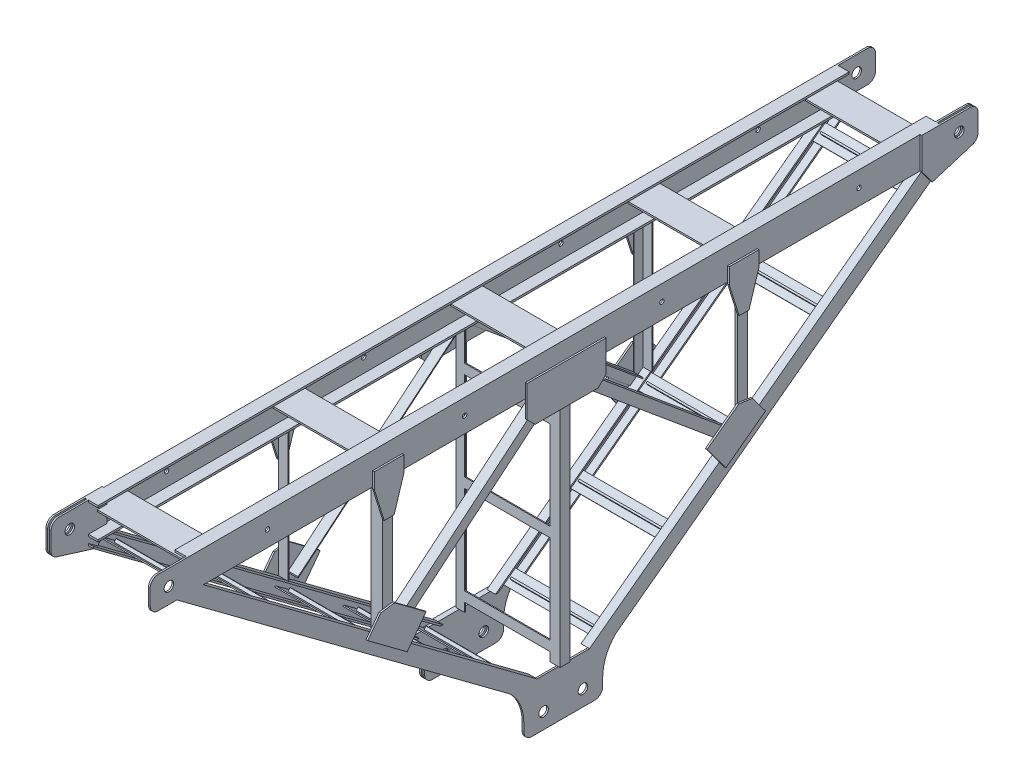
from build123d import *

# Parameters (mm, degrees)
EXTRUDE_1_DEPTH           = 4190
EXTRUDE_1_2_DEPTH         = 4190
SKETCH_7_W                = 400
SKETCH_7_H                = 240
EXTRUDE_4_DEPTH           = 520
SKETCH_8_W                = 503
SKETCH_8_H                = 400
CUT_EXTRUDE_5_DEPTH       = 4455.537012979
SKETCH_9_R                = 11
CUT_EXTRUDE_6_DEPTH       = 4481.68075185
EXTRUDE_8_DEPTH           = 43
EXTRUDE_8_2_DEPTH         = 43
CUT_EXTRUDE_9_DEPTH       = 38
EXTRUDE_10_DEPTH          = 43
EXTRUDE_10_2_DEPTH        = 43
CUT_EXTRUDE_11_DEPTH      = 38
SKETCH_17_W               = 50
SKETCH_17_H               = 1260
EXTRUDE_12_DEPTH          = 528.5
EXTRUDE_12_2_DEPTH        = 528.5
EXTRUDE_12_3_DEPTH        = 528.5
CUT_EXTRUDE_13_DEPTH      = 1260
SKETCH_22_W               = 390
SKETCH_22_H               = 1000
CUT_EXTRUDE_14_DEPTH      = 3414.167480508
SKETCH_23_W               = 50
SKETCH_23_H               = 707.63301644
CUT_EXTRUDE_15_DEPTH      = 15
SKETCH_25_W               = 50
SKETCH_25_H               = 707.63301644
CUT_EXTRUDE_16_DEPTH      = 15
CUT_EXTRUDE_17_DEPTH      = 45
CUT_EXTRUDE_18_DEPTH      = 45
EXTRUDE_19_DEPTH          = 50
CUT_EXTRUDE_20_DEPTH      = 45
EXTRUDE_21_DEPTH          = 50
CUT_EXTRUDE_22_DEPTH      = 45
SKETCH_32_W               = 400
SKETCH_32_H               = 200
EXTRUDE_23_DEPTH          = 8.5
PATTERN_LINEAR_7_COUNT    = 2
PATTERN_LINEAR_7_PITCH    = 537
EXTRUDE_24_DEPTH          = 520
PATTERN_LINEAR_8_COUNT    = 5
PATTERN_LINEAR_8_PITCH    = 900
EXTRUDE_25_DEPTH          = 520
SKETCH_35_W               = 448.5
SKETCH_35_H               = 8.5
EXTRUDE_26_DEPTH          = 15
PATTERN_LINEAR_9_COUNT    = 3
PATTERN_LINEAR_9_PITCH    = 430
PATTERN_LINEAR_10_COUNT   = 3
PATTERN_LINEAR_10_PITCH   = 550
MIRROR_13_COPY_1_DEPTH    = 520
MIRROR_13_COPY_2_DEPTH    = 520
MIRROR_13_COPY_3_SKETCH_W = 448.5
MIRROR_13_COPY_3_SKETCH_H = 8.5
MIRROR_13_COPY_3_DEPTH    = 15
MIRROR_13_COPY_4_SKETCH_W = 448.5
MIRROR_13_COPY_4_SKETCH_H = 8.5
MIRROR_13_COPY_4_DEPTH    = 15
MIRROR_13_COPY_5_DEPTH    = 520
MIRROR_13_COPY_6_DEPTH    = 520
MIRROR_13_COPY_7_SKETCH_W = 448.5
MIRROR_13_COPY_7_SKETCH_H = 8.5
MIRROR_13_COPY_7_DEPTH    = 15
MIRROR_13_COPY_8_SKETCH_W = 448.5
MIRROR_13_COPY_8_SKETCH_H = 8.5
MIRROR_13_COPY_8_DEPTH    = 15
SKETCH_36_W               = 50
SKETCH_36_H               = 50
EXTRUDE_27_DEPTH          = 520
SKETCH_37_W               = 510
SKETCH_37_H               = 45
CUT_EXTRUDE_28_DEPTH      = 45
PATTERN_LINEAR_11_COUNT   = 2
PATTERN_LINEAR_11_PITCH   = 500
PATTERN_LINEAR_13_COUNT   = 2
PATTERN_LINEAR_13_PITCH   = 500
SKETCH_38_W               = 503
SKETCH_38_H               = 190
CUT_EXTRUDE_29_DEPTH      = 4539.729888416
EXTRUDE_30_DEPTH          = 8.5
PATTERN_LINEAR_14_COUNT   = 2
PATTERN_LINEAR_14_PITCH   = 17
SKETCH_41_W               = 8.5
SKETCH_41_H               = 190
CUT_EXTRUDE_31_DEPTH      = 4539.729888416
SKETCH_42_R               = 24.25
CUT_EXTRUDE_32_DEPTH      = 4483.68546744
EXTRUDE_33_DEPTH          = 8.5
PATTERN_LINEAR_15_COUNT   = 2
PATTERN_LINEAR_15_PITCH   = 17
SKETCH_44_W               = 8.5
SKETCH_44_H               = 190
CUT_EXTRUDE_34_DEPTH      = 160
SKETCH_45_R               = 24.25
CUT_EXTRUDE_35_DEPTH      = 4484.711659998
FILLET_1_R                = 40
CHAMFER_1_SIZE            = 50
EXTRUDE_37_DEPTH          = 8.5
PATTERN_LINEAR_16_COUNT   = 3
PATTERN_LINEAR_16_PITCH   = 8.5
SKETCH_48_W               = 8.5
SKETCH_48_H               = 600
CUT_EXTRUDE_38_DEPTH      = 160
EXTRUDE_39_DEPTH          = 8.5
FILLET_2_R                = 40
SKETCH_50_R               = 24.25
CUT_EXTRUDE_40_DEPTH      = 4484.711659998
SKETCH_51_W               = 494.5
SKETCH_51_H               = 1000
CUT_EXTRUDE_41_DEPTH      = 4457.553488964
CHAMFER_2_SIZE            = 40
SKETCH_52_R               = 11
CUT_EXTRUDE_42_DEPTH      = 4482.675161142
PATTERN_LINEAR_17_COUNT   = 4
PATTERN_LINEAR_17_PITCH   = 1000


with BuildPart() as part:
    # 草图2 → 拉伸1 (new body)
    with BuildSketch(Plane.XY):
        Polygon((0, 0), (0, 160), (65, 160), (65, 150), (8.5, 150), (8.5, 10), (65, 10), (65, 0), align=None)
    extrude(amount=EXTRUDE_1_DEPTH)



with BuildPart() as body_2:
    # 草图2 → Extrude 1 2 (new body)
    with BuildSketch(Plane.XY):
        Polygon((455, 160), (520, 160), (520, 0), (455, 0), (455, 10), (511.5, 10), (511.5, 150), (455, 150), align=None)
    extrude(amount=EXTRUDE_1_2_DEPTH)



with BuildPart() as body_3:
    # 草图7 → 拉伸4 (new body)
    with BuildSketch(Plane(origin=(520, 0, 0), x_dir=(0, 0, -1), z_dir=(1, 0, 0))):
        with Locations((-2095, -1380)):
            Rectangle(SKETCH_7_W, SKETCH_7_H)
    extrude(amount=-EXTRUDE_4_DEPTH)

    # 草图8 → 拉伸5 (cut, through all)
    with BuildSketch(Plane(origin=(0, -1260, 0), x_dir=(1, 0, 0), z_dir=(0, 1, 0))):
        with Locations((260, -2095)):
            Rectangle(SKETCH_8_W, SKETCH_8_H)
    extrude(amount=-CUT_EXTRUDE_5_DEPTH, mode=Mode.SUBTRACT)


with BuildPart() as cut_extrude_5_piece_1:
    # of the separate pieces the step leaves, piece 1, a body of its own (cut_extrude_5_pieces)
    add(body_3.part.solids().sort_by_distance((8.5, -1260, 2295))[0])


with BuildPart() as cut_extrude_5_piece_2:
    # of the separate pieces the step leaves, piece 2, a body of its own (cut_extrude_5_pieces)
    add(body_3.part.solids().sort_by_distance((520, -1260, 2295))[0])


with BuildPart() as cut_extrude_6_tool:
    # 草图9 → 拉伸6 (new, through all)
    with BuildSketch(Plane(origin=(520, 0, 0), x_dir=(0, 0, -1), z_dir=(1, 0, 0))):
        with Locations((-2195, -1420)):
            Circle(SKETCH_9_R)
        with Locations((-1995, -1420)):
            Circle(SKETCH_9_R)
    extrude(amount=-CUT_EXTRUDE_6_DEPTH)


with BuildPart() as cut_extrude_5_piece_1_1:
    add(cut_extrude_5_piece_1.part)

    # 拉伸6: cut by cut_extrude_6_tool
    add(cut_extrude_6_tool.part, mode=Mode.SUBTRACT)


with BuildPart() as cut_extrude_5_piece_2_1:
    add(cut_extrude_5_piece_2.part)

    # 拉伸6: cut by cut_extrude_6_tool
    add(cut_extrude_6_tool.part, mode=Mode.SUBTRACT)


with BuildPart() as body_5:
    # 草图13 → 拉伸8 (new body)
    with BuildSketch(Plane(origin=(520, 0, 0), x_dir=(0, 0, -1), z_dir=(1, 0, 0))):
        Polygon((-1961.985500305, -1260), (-1895, -1260), (-1895, -1309.86698356), (-135.477186263, 0), (-269.448186872, 0), align=None)
    extrude(amount=-EXTRUDE_8_DEPTH)


with BuildPart() as body_6:
    # 草图13 → Extrude 8 2 (new body)
    with BuildSketch(Plane(origin=(520, 0, 0), x_dir=(0, 0, -1), z_dir=(1, 0, 0))):
        Polygon((-2228.014499695, -1260), (-2295, -1260), (-2295, -1309.86698356), (-4054.522813737, 0), (-3920.551813128, 0), align=None)
    extrude(amount=-EXTRUDE_8_2_DEPTH)


with BuildPart() as cut_extrude_9_tool:
    # 草图14 → 拉伸9 (new body)
    with BuildSketch(Plane.ZY.offset(-477)):
        Polygon((3933.948913189, 0), (4041.125713677, 0), (2295, -1299.893586848), (2295, -1260), (2241.411599756, -1260), align=None)
        Polygon((148.874286323, 0), (256.051086811, 0), (1948.588400244, -1260), (1895, -1260), (1895, -1299.893586848), align=None)
    extrude(amount=-CUT_EXTRUDE_9_DEPTH)


with BuildPart() as body_5_1:
    add(body_5.part)

    # 拉伸9: cut by cut_extrude_9_tool
    add(cut_extrude_9_tool.part, mode=Mode.SUBTRACT)


with BuildPart() as body_6_1:
    add(body_6.part)

    # 拉伸9: cut by cut_extrude_9_tool
    add(cut_extrude_9_tool.part, mode=Mode.SUBTRACT)


with BuildPart() as body_7:
    # 草图15 → 拉伸10 (new body)
    with BuildSketch(Plane.ZY):
        Polygon((3920.551813128, 0), (4054.522813737, 0), (2295, -1309.86698356), (2295, -1260), (2228.014499695, -1260), align=None)
    extrude(amount=-EXTRUDE_10_DEPTH)


with BuildPart() as body_8:
    # 草图15 → Extrude 10 2 (new body)
    with BuildSketch(Plane.ZY):
        Polygon((135.477186263, 0), (269.448186872, 0), (1961.985500305, -1260), (1895, -1260), (1895, -1309.86698356), align=None)
    extrude(amount=-EXTRUDE_10_2_DEPTH)


with BuildPart() as cut_extrude_11_tool:
    # 草图16 → 拉伸11 (new body)
    with BuildSketch(Plane(origin=(43, 0, 0), x_dir=(0, 0, -1), z_dir=(1, 0, 0))):
        Polygon((-3933.948913189, 0), (-4041.125713677, 0), (-2295, -1299.893586848), (-2295, -1260), (-2241.411599756, -1260), align=None)
        Polygon((-256.051086811, 0), (-148.874286323, 0), (-1895, -1299.893586848), (-1895, -1260), (-1948.588400244, -1260), align=None)
    extrude(amount=-CUT_EXTRUDE_11_DEPTH)


with BuildPart() as body_7_1:
    add(body_7.part)

    # 拉伸11: cut by cut_extrude_11_tool
    add(cut_extrude_11_tool.part, mode=Mode.SUBTRACT)


with BuildPart() as body_8_1:
    add(body_8.part)

    # 拉伸11: cut by cut_extrude_11_tool
    add(cut_extrude_11_tool.part, mode=Mode.SUBTRACT)


with BuildPart() as body_9:
    # 草图17 → 拉伸12 (new body)
    with BuildSketch(Plane.ZY):
        with Locations((2095, -630)):
            Rectangle(SKETCH_17_W, SKETCH_17_H)
    extrude(amount=-EXTRUDE_12_DEPTH)

    # 草图18 → 拉伸13 (cut)
    with BuildSketch(Plane.XZ.offset(1260)):
        Polygon((5, 2115), (43, 2115), (43, 2120), (477, 2120), (477, 2115), (515, 2115), (515, 2070), (5, 2070), align=None)
    extrude(amount=-CUT_EXTRUDE_13_DEPTH, mode=Mode.SUBTRACT)


with BuildPart() as body_10:
    # 草图17 → Extrude 12 2 (new body)
    with BuildSketch(Plane.ZY):
        Polygon((2970, 0), (2970, -707.63301644), (3020, -670.410794218), (3020, 0), align=None)
    extrude(amount=-EXTRUDE_12_2_DEPTH)


with BuildPart() as body_11:
    # 草图17 → Extrude 12 3 (new body)
    with BuildSketch(Plane.ZY):
        Polygon((1170, 0), (1170, -670.410794218), (1220, -707.63301644), (1220, 0), align=None)
    extrude(amount=-EXTRUDE_12_3_DEPTH)


with BuildPart() as cut_extrude_13_piece_1:
    # of the separate pieces the step leaves, piece 1, a body of its own (cut_extrude_13_pieces)
    add(body_9.part.solids().sort_by_distance((515, 0, 2115))[0])


with BuildPart() as cut_extrude_13_piece_2:
    # of the separate pieces the step leaves, piece 2, a body of its own (cut_extrude_13_pieces)
    add(body_9.part.solids().sort_by_distance((0, 0, 2070))[0])


with BuildPart() as cut_extrude_14_tool:
    # 草图22 → 拉伸14 (new, through all)
    with BuildSketch(Plane.XY.offset(3020)):
        with Locations((260, -500)):
            Rectangle(SKETCH_22_W, SKETCH_22_H)
    extrude(amount=-CUT_EXTRUDE_14_DEPTH)


with BuildPart() as body_10_1:
    add(body_10.part)

    # 拉伸14: cut by cut_extrude_14_tool
    add(cut_extrude_14_tool.part, mode=Mode.SUBTRACT)


with BuildPart() as body_11_1:
    add(body_11.part)

    # 拉伸14: cut by cut_extrude_14_tool
    add(cut_extrude_14_tool.part, mode=Mode.SUBTRACT)


with BuildPart() as cut_extrude_14_piece_1:
    # of the separate pieces the step leaves, piece 1, a body of its own (cut_extrude_14_pieces)
    add(body_10_1.part.solids().sort_by_distance((455, -707.63301644, 2970))[0])


with BuildPart() as cut_extrude_14_piece_2:
    # of the separate pieces the step leaves, piece 2, a body of its own (cut_extrude_14_pieces)
    add(body_10_1.part.solids().sort_by_distance((0, 0, 2970))[0])


with BuildPart() as cut_extrude_14_piece_1_of_body_11:
    # of the separate pieces the step leaves, piece 1, a body of its own (cut_extrude_14_pieces_of_body_11)
    add(body_11_1.part.solids().sort_by_distance((455, -670.410794218, 1170))[0])


with BuildPart() as cut_extrude_14_piece_2_of_body_11:
    # of the separate pieces the step leaves, piece 2, a body of its own (cut_extrude_14_pieces_of_body_11)
    add(body_11_1.part.solids().sort_by_distance((0, 0, 1170))[0])


with BuildPart() as cut_extrude_15_tool:
    # 草图23 → 拉伸15 (new body)
    with BuildSketch(Plane.ZY.offset(-455)):
        with Locations((1195, -353.81650822)):
            Rectangle(SKETCH_23_W, SKETCH_23_H)
        with Locations((2995, -353.81650822)):
            Rectangle(SKETCH_23_W, SKETCH_23_H)
    extrude(amount=-CUT_EXTRUDE_15_DEPTH)


with BuildPart() as cut_extrude_14_piece_1_1:
    add(cut_extrude_14_piece_1.part)

    # 拉伸15: cut by cut_extrude_15_tool
    add(cut_extrude_15_tool.part, mode=Mode.SUBTRACT)


with BuildPart() as cut_extrude_14_piece_1_of_body_11_1:
    add(cut_extrude_14_piece_1_of_body_11.part)

    # 拉伸15: cut by cut_extrude_15_tool
    add(cut_extrude_15_tool.part, mode=Mode.SUBTRACT)


with BuildPart() as cut_extrude_16_tool:
    # 草图25 → 拉伸16 (new body)
    with BuildSketch(Plane(origin=(65, 0, 0), x_dir=(0, 0, -1), z_dir=(1, 0, 0))):
        with Locations((-2995, -353.81650822)):
            Rectangle(SKETCH_25_W, SKETCH_25_H)
        with Locations((-1195, -353.81650822)):
            Rectangle(SKETCH_25_W, SKETCH_25_H)
    extrude(amount=-CUT_EXTRUDE_16_DEPTH)


with BuildPart() as cut_extrude_14_piece_2_1:
    add(cut_extrude_14_piece_2.part)

    # 拉伸16: cut by cut_extrude_16_tool
    add(cut_extrude_16_tool.part, mode=Mode.SUBTRACT)


with BuildPart() as cut_extrude_14_piece_2_of_body_11_1:
    add(cut_extrude_14_piece_2_of_body_11.part)

    # 拉伸16: cut by cut_extrude_16_tool
    add(cut_extrude_16_tool.part, mode=Mode.SUBTRACT)


with BuildPart() as cut_extrude_17_tool:
    # 草图26 → 拉伸17 (new body)
    with BuildSketch(Plane(origin=(50, 0, 0), x_dir=(0, 0, -1), z_dir=(1, 0, 0))):
        Polygon((-3015, 0), (-2970, 0), (-2970, -707.63301644), (-3015, -674.13301644), align=None)
        Polygon((-1175, 0), (-1220, 0), (-1220, -707.63301644), (-1175, -674.13301644), align=None)
    extrude(amount=-CUT_EXTRUDE_17_DEPTH)


with BuildPart() as cut_extrude_14_piece_2_2:
    add(cut_extrude_14_piece_2_1.part)

    # 拉伸17: cut by cut_extrude_17_tool
    add(cut_extrude_17_tool.part, mode=Mode.SUBTRACT)


with BuildPart() as cut_extrude_14_piece_2_of_body_11_2:
    add(cut_extrude_14_piece_2_of_body_11_1.part)

    # 拉伸17: cut by cut_extrude_17_tool
    add(cut_extrude_17_tool.part, mode=Mode.SUBTRACT)


with BuildPart() as cut_extrude_18_tool:
    # 草图27 → 拉伸18 (new body)
    with BuildSketch(Plane.ZY.offset(-470)):
        Polygon((3015, 0), (2970, 0), (2970, -707.63301644), (3015, -674.13301644), align=None)
        Polygon((1175, 0), (1220, 0), (1220, -707.63301644), (1175, -674.13301644), align=None)
    extrude(amount=-CUT_EXTRUDE_18_DEPTH)


with BuildPart() as cut_extrude_14_piece_1_2:
    add(cut_extrude_14_piece_1_1.part)

    # 拉伸18: cut by cut_extrude_18_tool
    add(cut_extrude_18_tool.part, mode=Mode.SUBTRACT)


with BuildPart() as cut_extrude_14_piece_1_of_body_11_2:
    add(cut_extrude_14_piece_1_of_body_11_1.part)

    # 拉伸18: cut by cut_extrude_18_tool
    add(cut_extrude_18_tool.part, mode=Mode.SUBTRACT)


with BuildPart() as part_1:
    add(part.part)

    add(body_7_1.part)  # 拉伸19 merges body 7

    add(body_8_1.part)  # 拉伸19 merges body 8

    add(cut_extrude_13_piece_2.part)  # 拉伸19 merges 拉伸13 piece 2

    add(cut_extrude_14_piece_2_2.part)  # 拉伸19 merges 拉伸14 piece 2

    add(cut_extrude_14_piece_2_of_body_11_2.part)  # 拉伸19 merges 拉伸14 piece 2 of body 11
    # 草图28 → 拉伸19 (add)
    with BuildSketch(Plane.ZY):
        Polygon((2120, -32.529524598), (2120, 0), (2159.074061365, 0), (2970, -675.103491842), (2970, -707.63301644), (2949.37192387, -722.989473114), align=None)
        Polygon((2030.925938635, 0), (2070, 0), (2070, -32.529524598), (1240.62807613, -722.989473114), (1220, -707.63301644), (1220, -675.103491842), align=None)
    extrude(amount=-EXTRUDE_19_DEPTH)

    # 草图29 → 拉伸20 (cut)
    with BuildSketch(Plane(origin=(50, 0, 0), x_dir=(0, 0, -1), z_dir=(1, 0, 0))):
        Polygon((-2038.740750908, 0), (-2070, 0), (-2070, -32.529524598), (-1240.62807613, -722.989473114), (-1220, -707.63301644), (-1220, -681.609396762), align=None)
        Polygon((-2151.259249092, 0), (-2120, 0), (-2120, -32.529524598), (-2949.37192387, -722.989473114), (-2970, -707.63301644), (-2970, -681.609396762), align=None)
    extrude(amount=-CUT_EXTRUDE_20_DEPTH, mode=Mode.SUBTRACT)

    # 草图32 → 拉伸23 (add)
    with BuildSketch(Plane.ZY):
        Polygon((1120, 80), (1270, 80), (1270, 0), (1220, -160), (1170, -160), (1120, 0), align=None)
        with Locations((2095, -20)):
            Rectangle(SKETCH_32_W, SKETCH_32_H)
        Polygon((2920, 80), (3070, 80), (3070, 0), (3020, -160), (2970, -160), (2920, 0), align=None)
        Polygon((2807.685821085, -666.399208617), (3008.21930609, -517.11316978), (3103.762370946, -645.454600184), (2903.228885941, -794.740639021), align=None)
        Polygon((1181.78069391, -517.11316978), (1382.314178915, -666.399208617), (1286.771114059, -794.740639021), (1086.237629054, -645.454600184), align=None)
    extrude_23 = extrude(amount=EXTRUDE_23_DEPTH)



with BuildPart() as body_2_1:
    add(body_2.part)

    add(body_5_1.part)  # 拉伸21 merges body 5

    add(body_6_1.part)  # 拉伸21 merges body 6

    add(cut_extrude_13_piece_1.part)  # 拉伸21 merges 拉伸13 piece 1

    add(cut_extrude_14_piece_1_2.part)  # 拉伸21 merges 拉伸14 piece 1

    add(cut_extrude_14_piece_1_of_body_11_2.part)  # 拉伸21 merges 拉伸14 piece 1 of body 11
    # 草图30 → 拉伸21 (add)
    with BuildSketch(Plane(origin=(520, 0, 0), x_dir=(0, 0, -1), z_dir=(1, 0, 0))):
        Polygon((-2070, 0), (-2030.925938635, 0), (-1220, -675.103491842), (-1220, -707.63301644), (-1240.62807613, -722.989473114), (-2070, -32.529524598), align=None)
        Polygon((-2120, 0), (-2120, -32.529524598), (-2949.37192387, -722.989473114), (-2970, -707.63301644), (-2970, -675.103491842), (-2159.074061365, 0), align=None)
    extrude(amount=-EXTRUDE_21_DEPTH)

    # 草图31 → 拉伸22 (cut)
    with BuildSketch(Plane.ZY.offset(-470)):
        Polygon((2120, 0), (2151.259249092, 0), (2970, -681.609396762), (2970, -707.63301644), (2949.37192387, -722.989473114), (2120, -32.529524598), align=None)
        Polygon((2038.740750908, 0), (2070, 0), (2070, -32.529524598), (1240.62807613, -722.989473114), (1220, -707.63301644), (1220, -681.609396762), align=None)
    extrude(amount=-CUT_EXTRUDE_22_DEPTH, mode=Mode.SUBTRACT)

    # 阵列(线性)7: 拉伸23 ×2
    with Locations(*[(i * PATTERN_LINEAR_7_PITCH, 0, 0) for i in range(1, PATTERN_LINEAR_7_COUNT)]):
        add(extrude_23)


with BuildPart() as part_2:
    add(part_1.part)

    add(body_2_1.part)  # 拉伸24 merges body 2
    # 草图33 → 拉伸24 (add)
    with BuildSketch(Plane.ZY):
        Polygon((195, 86.5), (270.75, 86.5), (270.75, 46.5), (279.25, 46.5), (279.25, 86.5), (355, 86.5), (355, 95), (195, 95), align=None)
    extrude_24 = extrude(amount=-EXTRUDE_24_DEPTH)

    # 阵列(线性)8: 拉伸24 ×5
    with Locations(*[(0, 0, i * PATTERN_LINEAR_8_PITCH) for i in range(1, PATTERN_LINEAR_8_COUNT)]):
        add(extrude_24)

    # 草图34 → 拉伸25 (add)
    with BuildSketch(Plane.ZY):
        Polygon((2975.888852008, -749.999390366), (2978.874572784, -754.010060066), (3043.045287986, -706.238527638), (3040.059567209, -702.227857938), align=None)
    extrude_25 = extrude(amount=-EXTRUDE_25_DEPTH)

    # 草图35 → 拉伸26 (add)
    with BuildSketch(Plane(origin=(0, -1907.98354433, 1420.387749668), x_dir=(1, 0, 0), z_dir=(0, 0.8021339400205775, -0.5971441553486599))):
        with Locations((264.25, -1977.453697452)):
            Rectangle(SKETCH_35_W, SKETCH_35_H)
    extrude_26 = extrude(amount=EXTRUDE_26_DEPTH)

    # 阵列(线性)9: 拉伸25, 拉伸26 ×3
    with Locations(*[Vector(6.559675283577416e-15, -0.5971441553486468, -0.8021339400205872) * (i * PATTERN_LINEAR_9_PITCH) for i in range(1, PATTERN_LINEAR_9_COUNT)]):
        add(extrude_25)
        add(extrude_26)

    # 阵列(线性)10: 拉伸25, 拉伸26 ×3
    with Locations(*[Vector(-6.547792611141547e-15, 0.5971441553486466, 0.8021339400205875) * (i * PATTERN_LINEAR_10_PITCH) for i in range(1, PATTERN_LINEAR_10_COUNT)]):
        add(extrude_25)
        add(extrude_26)

    # 镜向13: 拉伸25, 拉伸26 across plane
    add(extrude_25.mirror(Plane.XY.offset(2095)))
    add(extrude_26.mirror(Plane.XY.offset(2095)))

    # 镜向13 copy 1 sketch → 镜向13 copy 1 (add)
    with BuildSketch(Plane(origin=(0, -256.7719868, 4534.917594209), x_dir=(0, 0, -1), z_dir=(-1, 0, 0))):
        Polygon((2975.888852008, 749.999390366), (2978.874572784, 754.010060066), (3043.045287986, 706.238527638), (3040.059567209, 702.227857938), align=None)
    extrude(amount=-MIRROR_13_COPY_1_DEPTH)

    # 镜向13 copy 2 sketch → 镜向13 copy 2 (add)
    with BuildSketch(Plane(origin=(0, -513.5439736, 4879.835188418), x_dir=(0, 0, -1), z_dir=(-1, 0, 0))):
        Polygon((2975.888852008, 749.999390366), (2978.874572784, 754.010060066), (3043.045287986, 706.238527638), (3040.059567209, 702.227857938), align=None)
    extrude(amount=-MIRROR_13_COPY_2_DEPTH)

    # 镜向13 copy 3 sketch → 镜向13 copy 3 (add)
    with BuildSketch(Plane(origin=(0, -2164.75553113, 3114.529844541), x_dir=(1, 0, 0), z_dir=(0, 0.8021339400205775, 0.5971441553486599))):
        with Locations((264.25, 1977.453697452)):
            Rectangle(MIRROR_13_COPY_3_SKETCH_W, MIRROR_13_COPY_3_SKETCH_H)
    extrude(amount=MIRROR_13_COPY_3_DEPTH)

    # 镜向13 copy 4 sketch → 镜向13 copy 4 (add)
    with BuildSketch(Plane(origin=(0, -2421.52751793, 3459.44743875), x_dir=(1, 0, 0), z_dir=(0, 0.8021339400205775, 0.5971441553486599))):
        with Locations((264.25, 1977.453697452)):
            Rectangle(MIRROR_13_COPY_4_SKETCH_W, MIRROR_13_COPY_4_SKETCH_H)
    extrude(amount=MIRROR_13_COPY_4_DEPTH)

    # 镜向13 copy 5 sketch → 镜向13 copy 5 (add)
    with BuildSketch(Plane(origin=(0, 328.429285442, 3748.826332989), x_dir=(0, 0, -1), z_dir=(-1, 0, 0))):
        Polygon((2975.888852008, 749.999390366), (2978.874572784, 754.010060066), (3043.045287986, 706.238527638), (3040.059567209, 702.227857938), align=None)
    extrude(amount=-MIRROR_13_COPY_5_DEPTH)

    # 镜向13 copy 6 sketch → 镜向13 copy 6 (add)
    with BuildSketch(Plane(origin=(0, 656.858570884, 3307.652665977), x_dir=(0, 0, -1), z_dir=(-1, 0, 0))):
        Polygon((2975.888852008, 749.999390366), (2978.874572784, 754.010060066), (3043.045287986, 706.238527638), (3040.059567209, 702.227857938), align=None)
    extrude(amount=-MIRROR_13_COPY_6_DEPTH)

    # 镜向13 copy 7 sketch → 镜向13 copy 7 (add)
    with BuildSketch(Plane(origin=(0, -1579.554258888, 2328.438583321), x_dir=(1, 0, 0), z_dir=(0, 0.8021339400205775, 0.5971441553486599))):
        with Locations((264.25, 1977.453697452)):
            Rectangle(MIRROR_13_COPY_7_SKETCH_W, MIRROR_13_COPY_7_SKETCH_H)
    extrude(amount=MIRROR_13_COPY_7_DEPTH)

    # 镜向13 copy 8 sketch → 镜向13 copy 8 (add)
    with BuildSketch(Plane(origin=(0, -1251.124973447, 1887.264916309), x_dir=(1, 0, 0), z_dir=(0, 0.8021339400205775, 0.5971441553486599))):
        with Locations((264.25, 1977.453697452)):
            Rectangle(MIRROR_13_COPY_8_SKETCH_W, MIRROR_13_COPY_8_SKETCH_H)
    extrude(amount=MIRROR_13_COPY_8_DEPTH)

    # 草图36 → 拉伸27 (add)
    with BuildSketch(Plane(origin=(520, 0, 0), x_dir=(0, 0, -1), z_dir=(1, 0, 0))):
        with Locations((-2095, -690)):
            Rectangle(SKETCH_36_W, SKETCH_36_H)
    extrude_27 = extrude(amount=-EXTRUDE_27_DEPTH)

    # 草图37 → 拉伸28 (cut)
    with BuildSketch(Plane(origin=(0, -665, 0), x_dir=(1, 0, 0), z_dir=(0, 1, 0))):
        with Locations((260, -2092.5)):
            Rectangle(SKETCH_37_W, SKETCH_37_H)
    cut_extrude_28 = extrude(amount=-CUT_EXTRUDE_28_DEPTH, mode=Mode.SUBTRACT)

    # 阵列(线性)11: 拉伸27, 拉伸28 ×2
    with Locations(*[(0, i * PATTERN_LINEAR_11_PITCH, 0) for i in range(1, PATTERN_LINEAR_11_COUNT)]):
        add(extrude_27)
        add(cut_extrude_28, mode=Mode.SUBTRACT)

    # 阵列(线性)13: 拉伸27, 拉伸28 ×2
    with Locations(*[(0, -i * PATTERN_LINEAR_13_PITCH, 0) for i in range(1, PATTERN_LINEAR_13_COUNT)]):
        add(extrude_27)
        add(cut_extrude_28, mode=Mode.SUBTRACT)

    # 草图38 → 拉伸29 (cut, through all)
    with BuildSketch(Plane(origin=(0, 160, 0), x_dir=(1, 0, 0), z_dir=(0, 1, 0))):
        with Locations((260, -95)):
            Rectangle(SKETCH_38_W, SKETCH_38_H)
        with Locations((260, -4095)):
            Rectangle(SKETCH_38_W, SKETCH_38_H)
    extrude(amount=-CUT_EXTRUDE_29_DEPTH, mode=Mode.SUBTRACT)

    # 草图39 → 拉伸30 (add)
    with BuildSketch(Plane(origin=(520, 0, 0), x_dir=(0, 0, -1), z_dir=(1, 0, 0))):
        Polygon((-285, 160), (0, 160), (0, 0), (-231.682984283, -71.619871859), (-285, 0), align=None)
    extrude_30 = extrude(amount=EXTRUDE_30_DEPTH)

    # 阵列(线性)14: 拉伸30 ×2
    with Locations(*[(-i * PATTERN_LINEAR_14_PITCH, 0, 0) for i in range(1, PATTERN_LINEAR_14_COUNT)]):
        add(extrude_30)

    # 草图41 → 拉伸31 (cut, through all)
    with BuildSketch(Plane(origin=(0, 160, 0), x_dir=(1, 0, 0), z_dir=(0, 1, 0))):
        with Locations((515.75, -95)):
            Rectangle(SKETCH_41_W, SKETCH_41_H)
    extrude(amount=-CUT_EXTRUDE_31_DEPTH, mode=Mode.SUBTRACT)

    # 草图42 → 拉伸32 (cut, through all)
    with BuildSketch(Plane(origin=(528.5, 0, 0), x_dir=(0, 0, -1), z_dir=(1, 0, 0))):
        with Locations((-95, 80)):
            Circle(SKETCH_42_R)
    extrude(amount=-CUT_EXTRUDE_32_DEPTH, mode=Mode.SUBTRACT)

    # 草图43 → 拉伸33 (add)
    with BuildSketch(Plane.ZY):
        Polygon((3905, 160), (3905, 0), (3958.317015717, -71.619871859), (4190, 0), (4190, 160), align=None)
    extrude_33 = extrude(amount=EXTRUDE_33_DEPTH)

    # 阵列(线性)15: 拉伸33 ×2
    with Locations(*[(i * PATTERN_LINEAR_15_PITCH, 0, 0) for i in range(1, PATTERN_LINEAR_15_COUNT)]):
        add(extrude_33)

    # 草图44 → 拉伸34 (cut)
    with BuildSketch(Plane(origin=(0, 160, 0), x_dir=(1, 0, 0), z_dir=(0, 1, 0))):
        with Locations((4.25, -4095)):
            Rectangle(SKETCH_44_W, SKETCH_44_H)
    extrude(amount=-CUT_EXTRUDE_34_DEPTH, mode=Mode.SUBTRACT)

    # 草图45 → 拉伸35 (cut, through all)
    with BuildSketch(Plane.ZY.offset(8.5)):
        with Locations((4095, 80)):
            Circle(SKETCH_45_R)
    extrude(amount=-CUT_EXTRUDE_35_DEPTH, mode=Mode.SUBTRACT)

    # 圆角1
    fillet_1_edges = [part_2.edges().sort_by_distance(p)[0] for p in [
        (4.25, 0, 0),
        (4.25, 160, 0),
        (507.25, 0, 0),
        (524.25, 0, 0),
        (507.25, 160, 0),
        (524.25, 160, 0),
        (-4.25, 0, 4190),
        (12.75, 0, 4190),
        (-4.25, 160, 4190),
        (12.75, 160, 4190),
        (515.75, 0, 4190),
        (515.75, 160, 4190),
    ]]
    fillet(fillet_1_edges, radius=FILLET_1_R)

    # 倒角1
    # the kernel refuses this chamfer: 50 mm, written as the material it takes off along each edge
    with BuildSketch(Plane(origin=(0, -517.11316978, 3008.21930609), x_dir=(0, -0.7854116647287853, 0.6189737610819688), z_dir=(-1, 0, 0)), Plane(origin=(665.584149398, -517.11316978, 3008.21930609), x_dir=(0, -0.7854116647287853, 0.6189737610819688), z_dir=(-1, 0, 0))) as chamfer_1_piece_1:
        Polygon((CHAMFER_1_SIZE * 0.999621916911, -CHAMFER_1_SIZE * 0.0274958766106), (-CHAMFER_1_SIZE * 0.0274958766106, -CHAMFER_1_SIZE * 0.999621916911), (0, 0), align=None)
    extrude(amount=137.084149398, mode=Mode.SUBTRACT)
    with BuildSketch(Plane(origin=(0, -517.11316978, 1181.78069391), x_dir=(0, -0.7854116647287853, -0.6189737610819688), z_dir=(-1, 0, 0)), Plane(origin=(665.584149398, -517.11316978, 1181.78069391), x_dir=(0, -0.7854116647287853, -0.6189737610819688), z_dir=(-1, 0, 0))) as chamfer_1_piece_2:
        Polygon((CHAMFER_1_SIZE * 0.999621916911, CHAMFER_1_SIZE * 0.0274958766106), (-CHAMFER_1_SIZE * 0.0274958766106, CHAMFER_1_SIZE * 0.999621916911), (0, 0), align=None)
    extrude(amount=137.084149398, mode=Mode.SUBTRACT)


    add(cut_extrude_5_piece_1_1.part)  # 拉伸37 merges 拉伸5 piece 1
    # 草图47 → 拉伸37 (add)
    with BuildSketch(Plane.ZY):
        with BuildLine():
            Line((1828.014499695, -1260), (2361.985500305, -1260))
            ThreePointArc((2361.985500305, -1260), (2312.422154247, -1333.271894332), (2295, -1420))
            Line((2295, -1420), (2295, -1500))
            Line((2295, -1500), (1895, -1500))
            Line((1895, -1500), (1895, -1420))
            ThreePointArc((1895, -1420), (1877.577845753, -1333.271894332), (1828.014499695, -1260))
        make_face()
    extrude_37 = extrude(amount=EXTRUDE_37_DEPTH)

    # 阵列(线性)16: 拉伸37 ×3
    with Locations(*[(i * PATTERN_LINEAR_16_PITCH, 0, 0) for i in range(1, PATTERN_LINEAR_16_COUNT)]):
        add(extrude_37)

    # 草图48 → 拉伸38 (cut)
    with BuildSketch(Plane.XZ.offset(1500)):
        with Locations((4.25, 2095)):
            Rectangle(SKETCH_48_W, SKETCH_48_H)
    extrude(amount=-CUT_EXTRUDE_38_DEPTH, mode=Mode.SUBTRACT)


    add(cut_extrude_5_piece_2_1.part)  # 拉伸39 merges 拉伸5 piece 2
    # 草图49 → 拉伸39 (add)
    with BuildSketch(Plane(origin=(520, 0, 0), x_dir=(0, 0, -1), z_dir=(1, 0, 0))):
        with BuildLine():
            Line((-2361.985500305, -1260), (-1828.014499695, -1260))
            ThreePointArc((-1828.014499695, -1260), (-1877.577845753, -1333.271894332), (-1895, -1420))
            Line((-1895, -1420), (-1895, -1500))
            Line((-1895, -1500), (-2295, -1500))
            Line((-2295, -1500), (-2295, -1420))
            ThreePointArc((-2295, -1420), (-2312.422154247, -1333.271894332), (-2361.985500305, -1260))
        make_face()
    extrude(amount=-EXTRUDE_39_DEPTH)

    # 圆角2
    fillet_2_edges = [part_2.edges().sort_by_distance(p)[0] for p in [
        (515.75, -1500, 2295),
        (515.75, -1500, 1895),
        (12.75, -1500, 1895),
        (12.75, -1500, 2295),
        (-4.25, -1500, 1895),
        (-4.25, -1500, 2295),
    ]]
    fillet(fillet_2_edges, radius=FILLET_2_R)

    # 草图50 → 拉伸40 (cut, through all)
    with BuildSketch(Plane.ZY.offset(8.5)):
        with Locations((1995, -1420)):
            Circle(SKETCH_50_R)
        with Locations((2195, -1420)):
            Circle(SKETCH_50_R)
    extrude(amount=-CUT_EXTRUDE_40_DEPTH, mode=Mode.SUBTRACT)

    # 草图51 → 拉伸41 (cut, through all)
    with BuildSketch(Plane.XZ.offset(1260)):
        with Locations((264.25, 2120)):
            Rectangle(SKETCH_51_W, SKETCH_51_H)
    extrude(amount=CUT_EXTRUDE_41_DEPTH, mode=Mode.SUBTRACT)

    # 倒角2
    # the kernel refuses this chamfer: 40 mm, written as the material it takes off along each edge
    with BuildSketch(Plane(origin=(0, -120, 1895), x_dir=(0, -0.027495876610586282, 0.9996219169112968), z_dir=(-1, 0, 0)), Plane(origin=(639.867319519, -120, 1895), x_dir=(0, -0.027495876610586282, 0.9996219169112968), z_dir=(-1, 0, 0))) as chamfer_2_piece_1:
        Polygon((CHAMFER_2_SIZE * 0.999621916911, CHAMFER_2_SIZE * 0.0274958766106), (-CHAMFER_2_SIZE * 0.0274958766106, CHAMFER_2_SIZE * 0.999621916911), (0, 0), align=None)
    extrude(amount=111.367319519, mode=Mode.SUBTRACT)
    with BuildSketch(Plane(origin=(0, -120, 2295), x_dir=(0, -0.02749587661058643, -0.9996219169112968), z_dir=(-1, 0, 0)), Plane(origin=(639.867319519, -120, 2295), x_dir=(0, -0.02749587661058643, -0.9996219169112968), z_dir=(-1, 0, 0))) as chamfer_2_piece_2:
        Polygon((CHAMFER_2_SIZE * 0.999621916911, -CHAMFER_2_SIZE * 0.0274958766106), (-CHAMFER_2_SIZE * 0.0274958766106, -CHAMFER_2_SIZE * 0.999621916911), (0, 0), align=None)
    extrude(amount=111.367319519, mode=Mode.SUBTRACT)

    # 草图52 → 拉伸42 (cut, through all)
    with BuildSketch(Plane(origin=(520, 0, 0), x_dir=(0, 0, -1), z_dir=(1, 0, 0))):
        with Locations((-3595, 80)):
            Circle(SKETCH_52_R)
    cut_extrude_42 = extrude(amount=-CUT_EXTRUDE_42_DEPTH, mode=Mode.SUBTRACT)

    # 阵列(线性)17: 拉伸42 ×4
    with Locations(*[(0, 0, -i * PATTERN_LINEAR_17_PITCH) for i in range(1, PATTERN_LINEAR_17_COUNT)]):
        add(cut_extrude_42, mode=Mode.SUBTRACT)


solid = part_2.part
